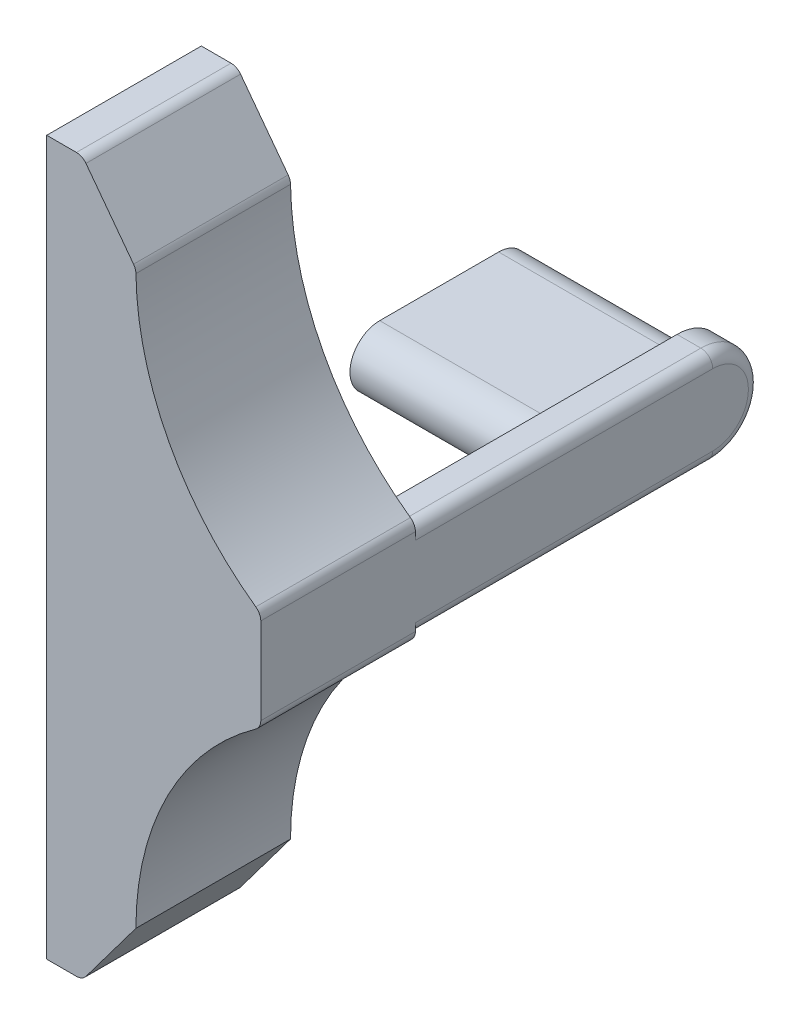
from build123d import *

# Parameters (mm, degrees)
EXTRUDE_1_DEPTH  = 13
EXTRUDE_2_DEPTH  = 3
EXTRUDE_3_DEPTH  = 15
FILLET_1_R       = 1
FILLET_2_R       = 1
FILLET_START     = -29.0000001
FILLET_3_DEPTH   = 29.0000001
FILLET_3_2_ANGLE = 180
FILLET_4_R       = 1
FILLET_5_R       = 1
FILLET_8_R       = 1


with BuildPart() as part:
    # 草图1 → 凸台-拉伸1 (new body)
    with BuildSketch(Plane.XY):
        with BuildLine():
            Line((-7.5, 114.244075086), (-12, 120.244075086))
            Line((-12, 120.244075086), (-15, 120.244075086))
            Line((-15, 120.244075086), (-15, 60.244075086))
            Line((-15, 60.244075086), (-12, 60.244075086))
            Line((-12, 60.244075086), (-7.5, 66.244075086))
            ThreePointArc((-7.5, 66.244075086), (-4.713203436, 77.469047246), (3, 86.087209919))
            Line((3, 86.087209919), (3, 94.400940253))
            ThreePointArc((3, 94.400940253), (-4.713203436, 103.019102925), (-7.5, 114.244075086))
        make_face()
    extrude(amount=EXTRUDE_1_DEPTH)

    # 草图3 → 凸台-拉伸2 (add)
    with BuildSketch(Plane(origin=(3, 0, 0), x_dir=(0, 0, -1), z_dir=(1, 0, 0))):
        with BuildLine():
            Line((1, 86.244075086), (-9, 86.244075086))
            ThreePointArc((-9, 86.244075086), (-13, 90.244075086), (-9, 94.244075086))
            Line((-9, 94.244075086), (1, 94.244075086))
            Line((1, 94.244075086), (15, 94.244075086))
            Line((15, 94.244075086), (25, 94.244075086))
            ThreePointArc((25, 94.244075086), (29, 90.244075086), (25, 86.244075086))
            Line((25, 86.244075086), (15, 86.244075086))
            Line((15, 86.244075086), (1, 86.244075086))
        make_face()
    extrude(amount=-EXTRUDE_2_DEPTH)

    # 草图4 → 凸台-拉伸3 (add)
    with BuildSketch(Plane.ZY):
        with BuildLine():
            Line((-15, 92.744075086), (-25, 92.744075086))
            ThreePointArc((-25, 92.744075086), (-27.5, 90.244075086), (-25, 87.744075086))
            Line((-25, 87.744075086), (-15, 87.744075086))
            ThreePointArc((-15, 87.744075086), (-12.5, 90.244075086), (-15, 92.744075086))
        make_face()
    extrude(amount=EXTRUDE_3_DEPTH)

    # 圆角1
    fillet_1_edges = [part.edges().sort_by_distance(p)[0] for p in [
        (3, 94.400940253, 6.5),
    ]]
    fillet(fillet_1_edges, radius=FILLET_1_R)

    # 圆角2
    fillet_2_edges = [part.edges().sort_by_distance(p)[0] for p in [
        (3, 86.087209919, 6.5),
    ]]
    fillet(fillet_2_edges, radius=FILLET_2_R)

    # 圆角3: read off the stored shape, not the designer's step
    # 圆角3 outline → 圆角3 (cut)
    with BuildSketch(Plane.XY.offset(FILLET_START)):
        with BuildLine():
            ThreePointArc((2, 94.244075086), (2.707106781, 93.951181867), (3, 93.244075086))
            Line((3, 93.244075086), (3, 93.878663231))
            ThreePointArc((3, 93.878663231), (2.9825594, 94.064612221), (2.930845947, 94.244075086))
            Line((2.930845947, 94.244075086), (2, 94.244075086))
        make_face()
        with BuildLine():
            Line((3, 86.60948694), (3, 87.244075086))
            ThreePointArc((3, 87.244075086), (2.707106781, 86.536968305), (2, 86.244075086))
            Line((2, 86.244075086), (2.930845947, 86.244075086))
            ThreePointArc((2.930845947, 86.244075086), (2.982559399, 86.423537951), (3, 86.60948694))
        make_face()
    extrude(amount=FILLET_3_DEPTH, mode=Mode.SUBTRACT)

    # Fillet 3 2 outline → Fillet 3 2 (revolve, cut)
    with BuildSketch(Plane(origin=(0, 90.244075086, -25), x_dir=(0, -1, 0), z_dir=(0, 0, 1))):
        with BuildLine():
            Line((4, 3), (3, 3))
            ThreePointArc((3, 3), (3.707106781, 2.707106781), (4, 2))
            Line((4, 2), (4, 3))
        make_face()
    revolve(axis=Axis((0, 90.244075086, -25), (1, 0, 0)), revolution_arc=FILLET_3_2_ANGLE, mode=Mode.SUBTRACT)

    # 圆角4
    fillet_4_edges = [part.edges().sort_by_distance(p)[0] for p in [
        (-12, 60.244075086, 6.5),
    ]]
    fillet(fillet_4_edges, radius=FILLET_4_R)

    # 圆角5
    fillet_5_edges = [part.edges().sort_by_distance(p)[0] for p in [
        (-12, 120.244075086, 6.5),
    ]]
    fillet(fillet_5_edges, radius=FILLET_5_R)

    # 圆角8
    fillet_8_edges = [part.edges().sort_by_distance(p)[0] for p in [
        (-7.5, 114.244075086, 6.5),
    ]]
    fillet(fillet_8_edges, radius=FILLET_8_R)


solid = part.part
